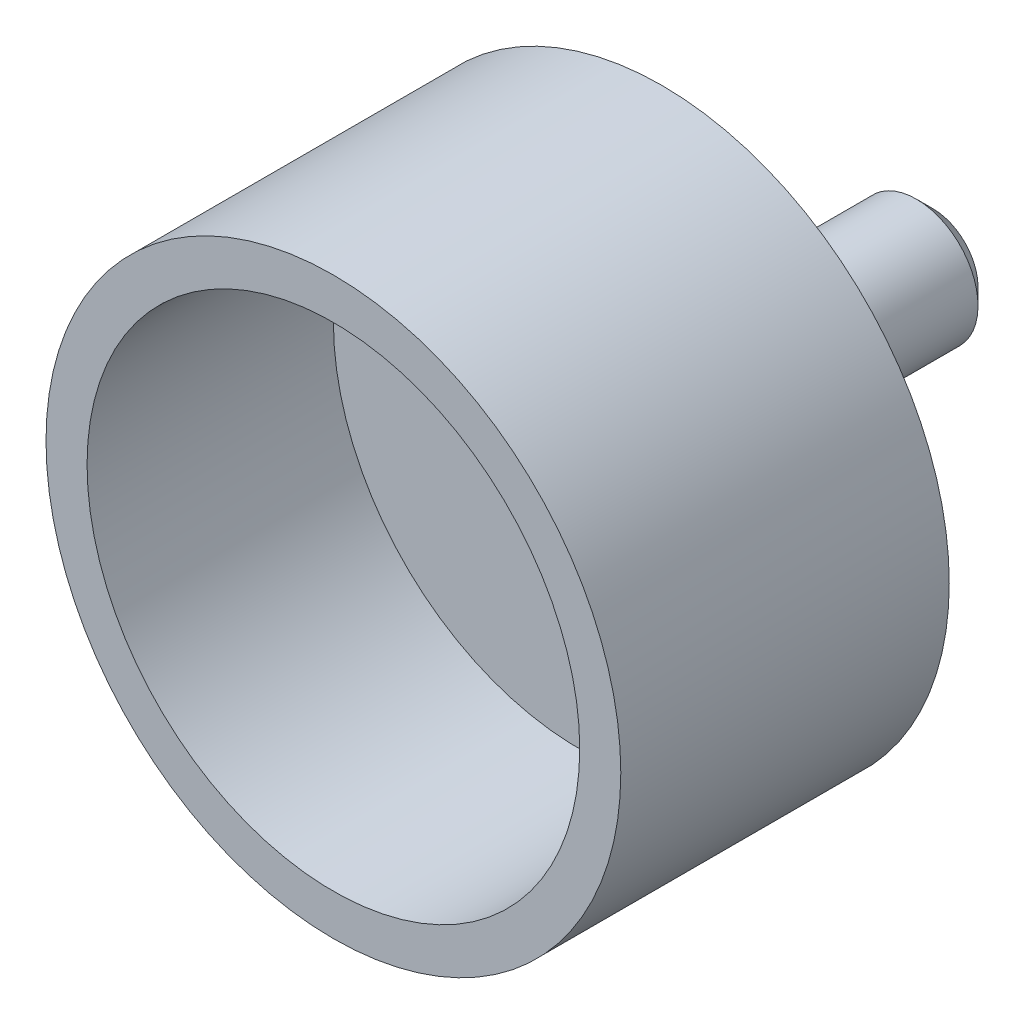
from build123d import *

# Parameters (mm, degrees)
SKETCH1_R           = 35
BOSS_EXTRUDE1_DEPTH = 35
SKETCH2_R           = 35
BOSS_EXTRUDE2_DEPTH = 5
SKETCH7_R           = 7.5
BOSS_EXTRUDE5_DEPTH = 26
CHAMFER1_SIZE       = 2
SKETCH8_R           = 18.7
CUT_EXTRUDE1_DEPTH  = 22
SKETCH11_R          = 30
CUT_EXTRUDE2_DEPTH  = 30


with BuildPart() as part:
    # Sketch1 → Boss-Extrude1 (new body)
    with BuildSketch(Plane.XY):
        Circle(SKETCH1_R)
    extrude(amount=BOSS_EXTRUDE1_DEPTH)

    # Sketch2 → Boss-Extrude2 (add)
    with BuildSketch(Plane.XY.offset(35)):
        Circle(SKETCH2_R)
    extrude(amount=BOSS_EXTRUDE2_DEPTH)

    # Loft1: read off the stored shape, not the designer's step
    # Loft1: loft between two sections, ruled curve by curve
    loft1_from = [
        Edge.make_bspline([(9.456775653, -3.251060481, 0), (2.954654692, -22.164611787, 0), (-15.958896614, -15.662490826, 0), (-9.456775653, 3.251060481, 0), (-2.954654692, 22.164611787, 0), (15.958896614, 15.662490826, 0), (9.456775653, -3.251060481, 0)], [0, 0, 0, 0, 0.5, 0.5, 0.5, 1, 1, 1, 1], 3, [1, 0.333333333, 0.333333333, 1, 0.333333333, 0.333333333, 1]),
    ]
    loft1_to = [
        Edge.make_bspline([(7.055763885, 2.542871605, -7), (12.141507096, -11.568656164, -7), (-1.970020674, -16.654399375, -7), (-7.055763885, -2.542871605, -7), (-12.141507096, 11.568656164, -7), (1.970020674, 16.654399375, -7), (7.055763885, 2.542871605, -7)], [0, 0, 0, 0, 0.5, 0.5, 0.5, 1, 1, 1, 1], 3, [1, 0.333333333, 0.333333333, 1, 0.333333333, 0.333333333, 1]),
    ]
    loft1 = Solid(Shell([*[Face.make_surface_from_curves(loft1_from[k], loft1_to[k]) for k in range(1)], Face(Wire(loft1_from)), Face(Wire(loft1_to))]))
    add(loft1)

    # Sketch7 → Boss-Extrude5 (add)
    with BuildSketch(Plane(origin=(0, 0, -7), x_dir=(-1, 0, 0), z_dir=(0, 0, -1))):
        with Locations(Location((0, 0, 0), (0, 0, 160.181022053))):
            Circle(SKETCH7_R)
    extrude(amount=BOSS_EXTRUDE5_DEPTH)

    # Chamfer1
    chamfer1_edges = [part.edges().sort_by_distance(p)[0] for p in [
        (-7.055763885, -2.542871605, -33),
    ]]
    chamfer(chamfer1_edges, length=CHAMFER1_SIZE)

    # Sketch8 → Cut-Extrude1 (cut)
    with BuildSketch(Plane.XY.offset(40)):
        Circle(SKETCH8_R)
    extrude(amount=-CUT_EXTRUDE1_DEPTH, mode=Mode.SUBTRACT)

    # Sketch11 → Cut-Extrude2 (cut)
    with BuildSketch(Plane.XY.offset(40)):
        Circle(SKETCH11_R)
    extrude(amount=-CUT_EXTRUDE2_DEPTH, mode=Mode.SUBTRACT)


solid = part.part
